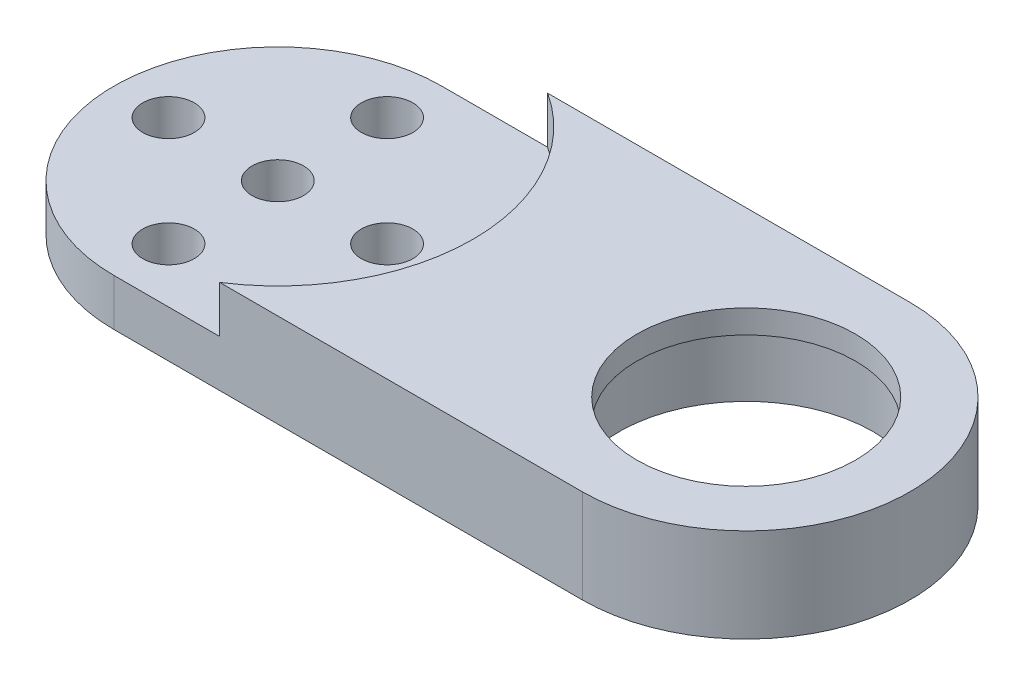
from build123d import *

# Parameters (mm, degrees)
BOSS_EXTRUDE1_DEPTH     = 6
SKETCH4_R               = 1.65
SERVO_HORN_HOLES_DEPTH  = 29.222331583
SKETCH5_R               = 8.15
BEARING_PRESS_FIT_DEPTH = 4.5
SKETCH7_R               = 12.5
CUT_EXTRUDE1_DEPTH      = 3
SKETCH8_R               = 7
CUT_EXTRUDE2_DEPTH      = 28.941904015


with BuildPart() as part:
    # Sketch2 → Boss-Extrude1 (new body)
    with BuildSketch(Plane(origin=(0, 0, 0), x_dir=(1, 0, 0), z_dir=(0, 1, 0))):
        with BuildLine():
            Line((15, 10.5), (-15, 10.5))
            ThreePointArc((-15, 10.5), (-25.5, 0), (-15, -10.5))
            Line((-15, -10.5), (15, -10.5))
            ThreePointArc((15, -10.5), (25.5, 0), (15, 10.5))
        make_face()
    extrude(amount=BOSS_EXTRUDE1_DEPTH)

    # Sketch4 → Servo horn holes (cut, through all)
    with BuildSketch(Plane(origin=(0, 6, 0), x_dir=(1, 0, 0), z_dir=(0, 1, 0))):
        with Locations((-15, 0)):
            Circle(SKETCH4_R)
        with Locations((-8, 0)):
            Circle(SKETCH4_R)
        with Locations((-15, -7)):
            Circle(SKETCH4_R)
        with Locations((-22, 0)):
            Circle(SKETCH4_R)
        with Locations((-15, 7)):
            Circle(SKETCH4_R)
    extrude(amount=-SERVO_HORN_HOLES_DEPTH, mode=Mode.SUBTRACT)

    # Sketch5 → Bearing press fit (cut)
    with BuildSketch(Plane(origin=(0, 0, 0), x_dir=(-1, 0, 0), z_dir=(0, -1, 0))):
        with Locations((-15, 0)):
            Circle(SKETCH5_R)
    extrude(amount=-BEARING_PRESS_FIT_DEPTH, mode=Mode.SUBTRACT)

    # Sketch7 → Cut-Extrude1 (cut)
    with BuildSketch(Plane(origin=(0, 6, 0), x_dir=(1, 0, 0), z_dir=(0, 1, 0))):
        with Locations((-15, 0)):
            Circle(SKETCH7_R)
    extrude(amount=-CUT_EXTRUDE1_DEPTH, mode=Mode.SUBTRACT)

    # Sketch8 → Cut-Extrude2 (cut, through all)
    with BuildSketch(Plane.XZ.offset(-4.5)):
        with Locations((15, 0)):
            Circle(SKETCH8_R)
    extrude(amount=-CUT_EXTRUDE2_DEPTH, mode=Mode.SUBTRACT)


solid = part.part
